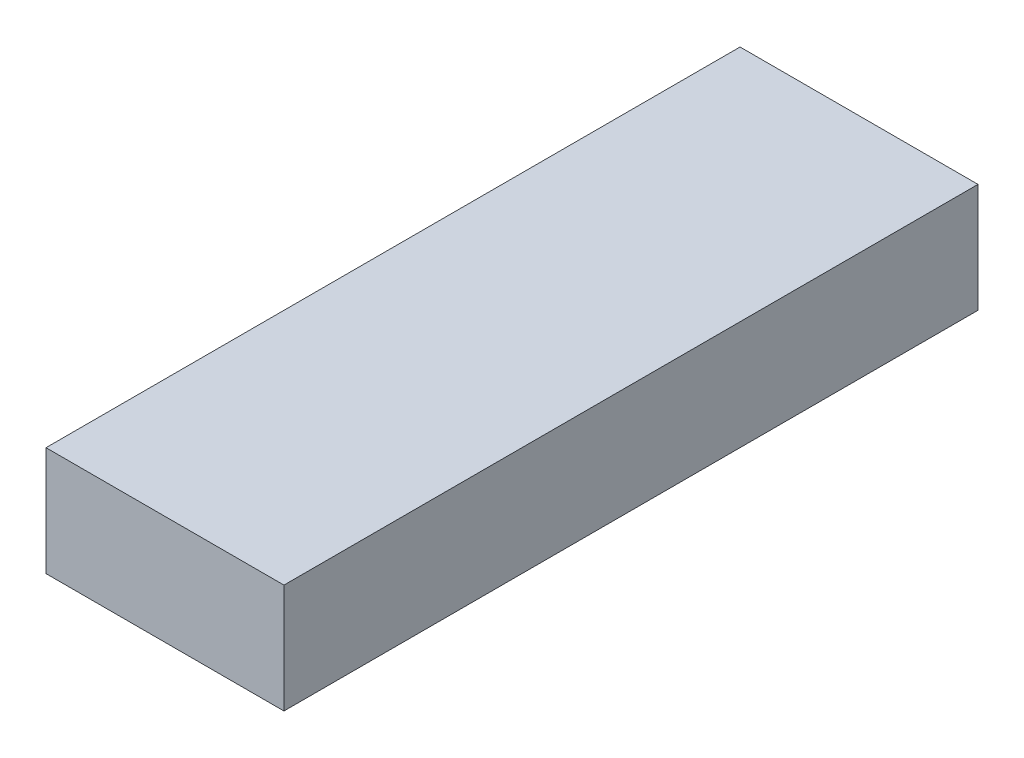
from build123d import *

# Parameters (mm, degrees)
SKETCH1_W           = 47.999904
SKETCH1_H           = 21.999956
BOSS_EXTRUDE1_DEPTH = 69.99986


with BuildPart() as part:
    # Sketch1 → Boss-Extrude1 (new, symmetric)
    with BuildSketch(Plane.XY):
        Rectangle(SKETCH1_W, SKETCH1_H)
    extrude(amount=BOSS_EXTRUDE1_DEPTH, both=True)


solid = part.part
